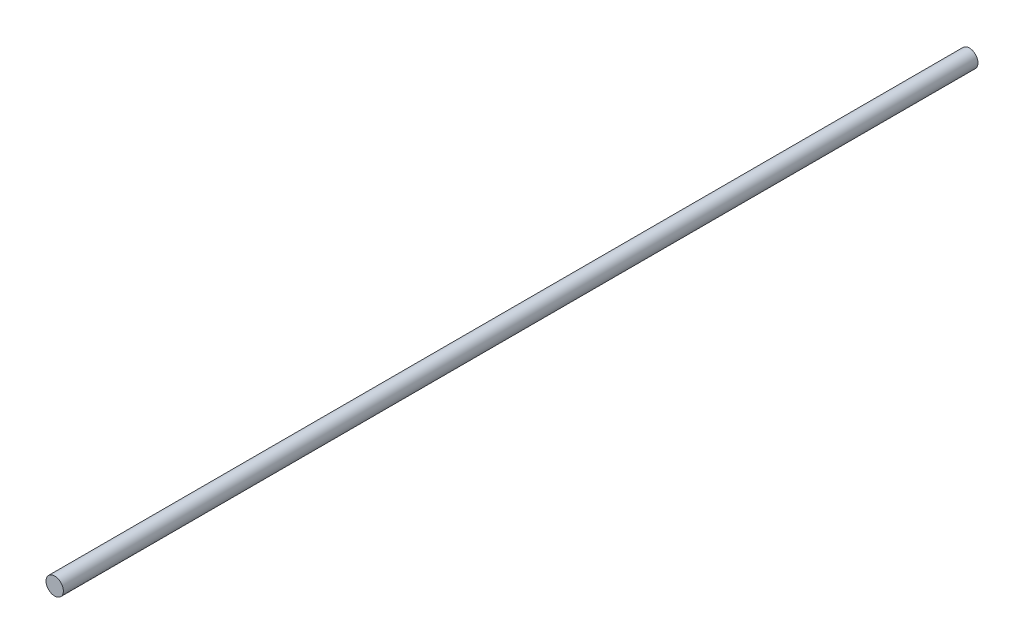
from build123d import *

# Parameters (mm, degrees)
SKETCH2_W = 421.4
SKETCH2_H = 4


with BuildPart() as part:
    # Sketch2 → Revolve1 (revolve)
    with BuildSketch(Plane(origin=(0, 0, 0), x_dir=(0, 0, -1), z_dir=(1, 0, 0))):
        with Locations((120.800000476, 2)):
            Rectangle(SKETCH2_W, SKETCH2_H)
    revolve(axis=Axis((0, 0, 89.899999524), (0, 0, -1)))


solid = part.part
